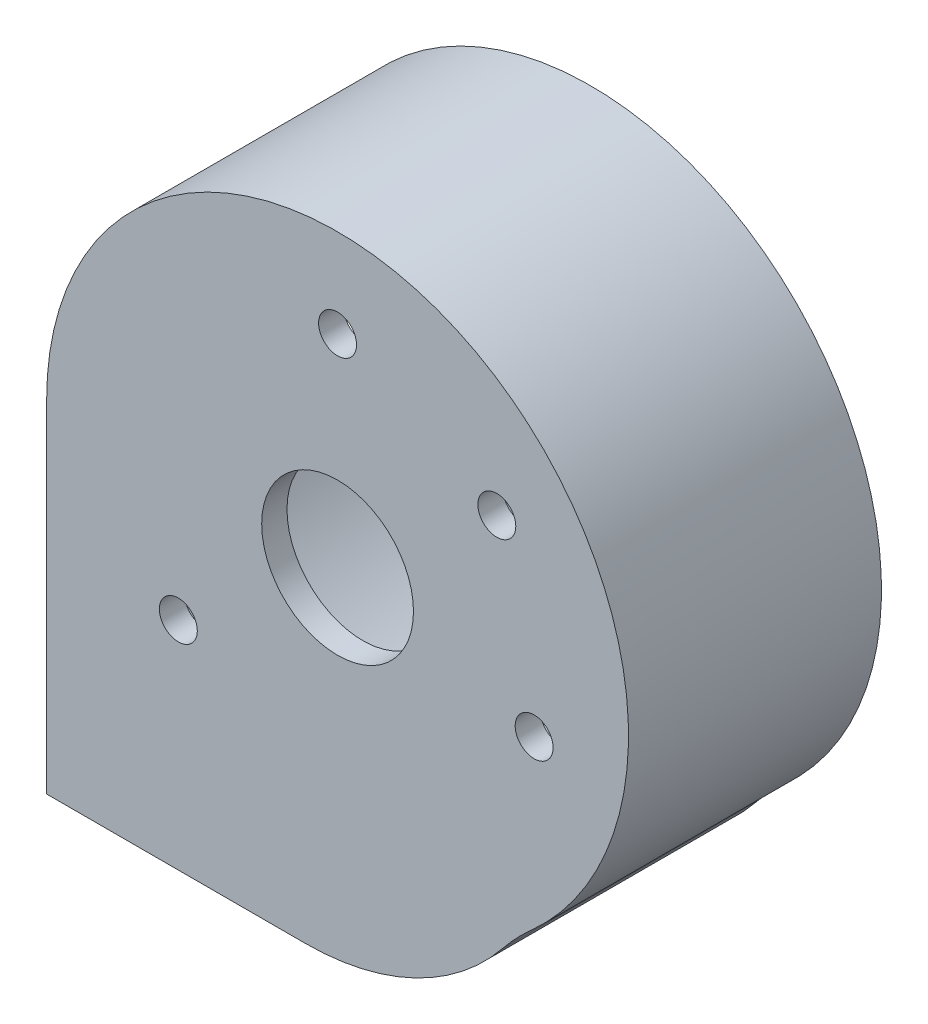
from build123d import *

# Parameters (mm, degrees)
SKETCH_1_R           = 1.5
SKETCH_1_R_2         = 6
EXTRUDE_1_DEPTH      = 20
SKETCH_3_R           = 21
CUT_EXTRUDE_11_DEPTH = 18
EXTRUDE_2_DEPTH      = 20
FILLET_3_R           = 3
SKETCH_5_R           = 1.5
CUT_EXTRUDE_12_DEPTH = 5


with BuildPart() as part:
    # 草图1 → 凸台-拉伸1 (new body)
    with BuildSketch(Plane.XY):
        with BuildLine():
            Line((-23, 0), (-23, -27))
            Line((-23, -27), (-2.527032193, -27))
            ThreePointArc((-2.527032193, -27), (6.11037495, -25.038713863), (13.053739404, -19.539519785))
            ThreePointArc((13.053739404, -19.539519785), (14.135978403, -18.302517785), (15.316133792, -17.158556049))
            ThreePointArc((15.316133792, -17.158556049), (9.400237305, 20.991320554), (-23, 0))
        make_face()
        with Locations((-12.589057749, -9.875)):
            Circle(SKETCH_1_R, mode=Mode.SUBTRACT)
        Circle(SKETCH_1_R_2, mode=Mode.SUBTRACT)
        with Locations((0, 16)):
            Circle(SKETCH_1_R, mode=Mode.SUBTRACT)
        with Locations((12.589057749, 9.875)):
            Circle(SKETCH_1_R, mode=Mode.SUBTRACT)
        with Locations((15.539618159, -3.810546875)):
            Circle(SKETCH_1_R, mode=Mode.SUBTRACT)
    extrude(amount=EXTRUDE_1_DEPTH)

    # 草图3 → 切除-拉伸11 (cut)
    with BuildSketch(Plane(origin=(0, 0, 0), x_dir=(-1, 0, 0), z_dir=(0, 0, -1))):
        Circle(SKETCH_3_R)
    extrude(amount=-CUT_EXTRUDE_11_DEPTH, mode=Mode.SUBTRACT)

    # 草图4 → 凸台-拉伸2 (add)
    with BuildSketch(Plane(origin=(0, 0, 0), x_dir=(-1, 0, 0), z_dir=(0, 0, -1))):
        with BuildLine():
            Line((2.527032193, -24), (2.527032193, -27))
            Line((2.527032193, -27), (23, -27))
            Line((23, -27), (23, -24))
            Line((23, -24), (23, -14.78470732))
            Line((23, -14.78470732), (19.073497874, -14.78470732))
            ThreePointArc((19.073497874, -14.78470732), (11.742066666, -21.083400155), (2.527032193, -24))
        make_face()
    extrude(amount=EXTRUDE_2_DEPTH)

    # 圆角3
    fillet_3_edges = [part.edges().sort_by_distance(p)[0] for p in [
        (-2.527032193, -25.5, 0),
        (-21.036748937, -14.78470732, 0),
        (-11.742066666, -21.083400155, 0),
    ]]
    fillet(fillet_3_edges, radius=FILLET_3_R)

    # 草图5 → 切除-拉伸12 (cut)
    with BuildSketch(Plane.XZ.offset(27)):
        with Locations((-18, 15)):
            Circle(SKETCH_5_R)
        with Locations((-6.527032193, 15)):
            Circle(SKETCH_5_R)
        with Locations((-6.527032193, -15)):
            Circle(SKETCH_5_R)
        with Locations((-18, -15)):
            Circle(SKETCH_5_R)
    extrude(amount=-CUT_EXTRUDE_12_DEPTH, mode=Mode.SUBTRACT)


solid = part.part
